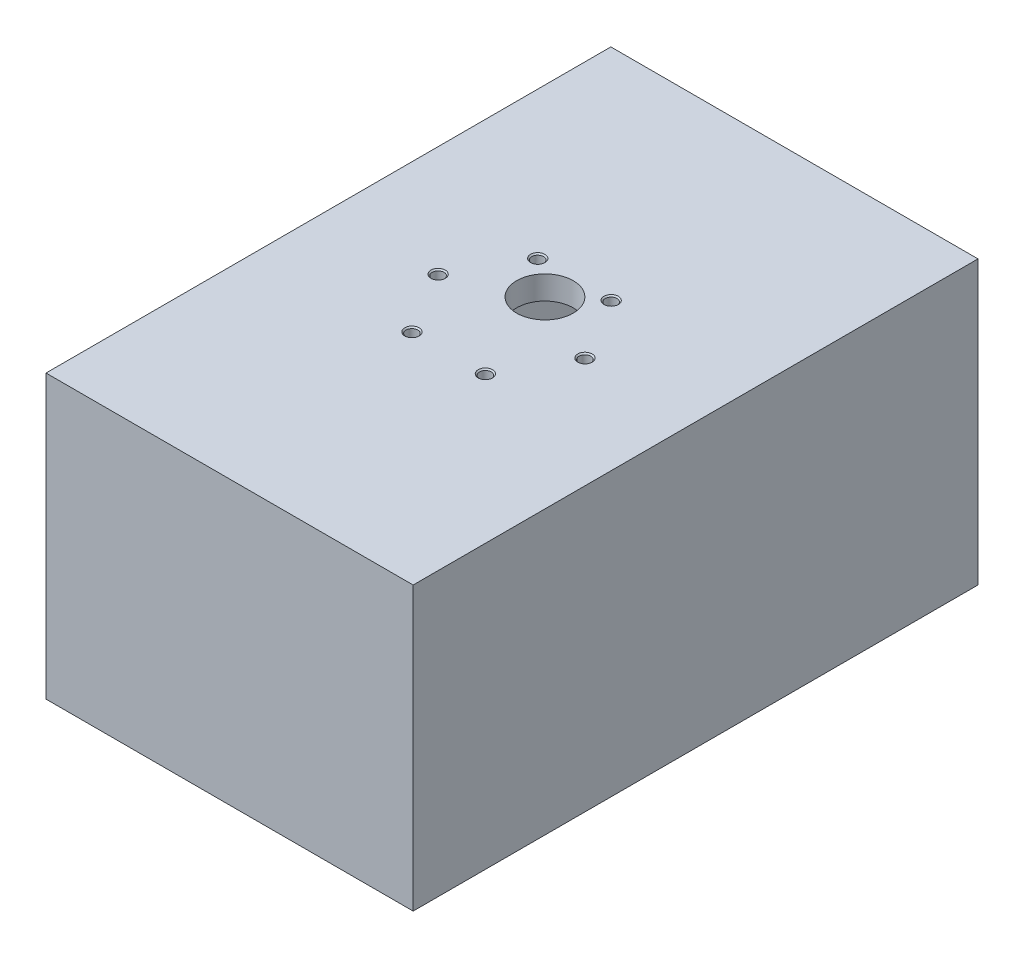
from build123d import *

# Parameters (mm, degrees)
IZIM1_R                     = 50
Y_KSEKLIK_EKSTR_ZYON1_DEPTH = 60
BO_ALTMA8_T                 = -5
IZIM2_R                     = 6
KES_EKSTR_ZYON1_DEPTH       = 60
DAIRESEL_KAPLAMA3_COUNT     = 6
IZIM6_R                     = 1.6
KES_EKSTR_ZYON2_DEPTH       = 4
DAIRESEL_KAPLAMA4_COUNT     = 6
IZIM7_W                     = 78
IZIM7_H                     = 120
Y_KSEKLIK_EKSTR_ZYON2_DEPTH = 60
KES_EKSTR_ZYON3_START       = -60
KES_EKSTR_ZYON3_DEPTH       = 60
BO_ALTMA9_T                 = -5
IZIM9_R                     = 6
KES_EKSTR_ZYON4_DEPTH       = 60
DAIRESEL_KAPLAMA5_COUNT     = 6


# Read off the part's stored shape, not the designer's step: M3x0.5 Dişli Delik1
with BuildPart() as part:
    # Çizim1 → Yükseklik-Ekstrüzyon1 (new body)
    with BuildSketch(Plane(origin=(0, 0, 0), x_dir=(1, 0, 0), z_dir=(0, 1, 0))):
        with Locations(Location((0, 0, 0), (0, 0, 270))):
            Circle(IZIM1_R)
    extrude(amount=Y_KSEKLIK_EKSTR_ZYON1_DEPTH)

    # İç Boşaltma8
    bo_altma8_openings = [part.faces().sort_by_distance(p)[0] for p in [
        (0, 0, 0),
    ]]
    offset(amount=BO_ALTMA8_T, openings=bo_altma8_openings, kind=Kind.INTERSECTION)

    # Çizim2 → Kes-Ekstrüzyon1 (cut)
    with BuildSketch(Plane(origin=(0, 60, 0), x_dir=(1, 0, 0), z_dir=(0, 1, 0))):
        with Locations(Location((0, 7, 0), (0, 0, 270))):
            Circle(IZIM2_R)
    extrude(amount=-KES_EKSTR_ZYON1_DEPTH, mode=Mode.SUBTRACT)

    # M3x0.5 Dişli Delik1 outline → M3x0.5 Dişli Delik1 (revolve, cut)
    with BuildSketch(Plane(origin=(15.5, 0, 0), x_dir=(1, 0, 0), z_dir=(0, 0, 1))):
        Polygon((0, 55), (1.25, 55), (1.25, 59.65), (1.6, 60), (0, 60), align=None)
    m3x0_5_di_li_delik1 = revolve(axis=Axis((15.5, 0, 0), (0, 1, 0)), mode=Mode.SUBTRACT)

    # Dairesel Kaplama3: M3x0.5 Dişli Delik1 ×6 about axis
    dairesel_kaplama3_axis = Axis((0, 0, 0), (0, 1, 0))
    for i in range(1, DAIRESEL_KAPLAMA3_COUNT):
        add(m3x0_5_di_li_delik1.rotate(dairesel_kaplama3_axis, i * 360 / DAIRESEL_KAPLAMA3_COUNT), mode=Mode.SUBTRACT)

    # Çizim6 → Kes-Ekstrüzyon2 (cut)
    with BuildSketch(Plane(origin=(0, 60, 0), x_dir=(1, 0, 0), z_dir=(0, 1, 0))):
        with Locations(Location((15.5, 0, 0), (0, 0, 270))):
            Circle(IZIM6_R)
    kes_ekstr_zyon2 = extrude(amount=-KES_EKSTR_ZYON2_DEPTH, mode=Mode.SUBTRACT)

    # Dairesel Kaplama4: Kes-Ekstrüzyon2 ×6 about axis
    dairesel_kaplama4_axis = Axis((0, 0, 0), (0, 1, 0))
    for i in range(1, DAIRESEL_KAPLAMA4_COUNT):
        add(kes_ekstr_zyon2.rotate(dairesel_kaplama4_axis, i * 360 / DAIRESEL_KAPLAMA4_COUNT), mode=Mode.SUBTRACT)

    # Çizim7 → Yükseklik-Ekstrüzyon2 (add)
    with BuildSketch(Plane(origin=(0, 60, 0), x_dir=(1, 0, 0), z_dir=(0, 1, 0))):
        Rectangle(IZIM7_W, IZIM7_H)
    extrude(amount=-Y_KSEKLIK_EKSTR_ZYON2_DEPTH)

    # Çizim8 → Kes-Ekstrüzyon3 (cut)
    with BuildSketch(Plane(origin=(0, 60, 0), x_dir=(1, 0, 0), z_dir=(0, 1, 0)).offset(KES_EKSTR_ZYON3_START)):
        with BuildLine():
            Line((-39, 31.288975694), (-39, -31.288975694))
            ThreePointArc((-39, -31.288975694), (-50, 0), (-39, 31.288975694))
        make_face()
        with BuildLine():
            Line((39, 31.288975694), (39, -31.288975694))
            ThreePointArc((39, -31.288975694), (50, 0), (39, 31.288975694))
        make_face()
    extrude(amount=KES_EKSTR_ZYON3_DEPTH, mode=Mode.SUBTRACT)

    # İç Boşaltma9
    bo_altma9_openings = [part.faces().sort_by_distance(p)[0] for p in [
        (0, 0, 0),
    ]]
    offset(amount=BO_ALTMA9_T, openings=bo_altma9_openings, kind=Kind.INTERSECTION)

    # Çizim9 → Kes-Ekstrüzyon4 (cut)
    with BuildSketch(Plane(origin=(0, 60, 0), x_dir=(1, 0, 0), z_dir=(0, 1, 0))):
        with Locations(Location((0, 7, 0), (0, 0, 270))):
            Circle(IZIM9_R)
    extrude(amount=-KES_EKSTR_ZYON4_DEPTH, mode=Mode.SUBTRACT)

    # Çizim16 → M3x0.5 Dişli Delik3 (revolve, cut)
    with BuildSketch(Plane(origin=(15.5, 60, 0), x_dir=(0, 0, 1), z_dir=(1, 0, 0))):
        Polygon((0, 0), (0, 9.251075774), (1.25, 8.5), (1.25, 0.275), (1.525, 0), align=None)
    m3x0_5_di_li_delik3 = revolve(axis=Axis((15.5, 66.35, 0), (0, -1, 0)), mode=Mode.SUBTRACT)

    # Dairesel Kaplama5: M3x0.5 Dişli Delik3 ×6 about axis
    dairesel_kaplama5_axis = Axis((-0.01225655, 0, 0.085683541), (0, 1, 0))
    for i in range(1, DAIRESEL_KAPLAMA5_COUNT):
        add(m3x0_5_di_li_delik3.rotate(dairesel_kaplama5_axis, i * 360 / DAIRESEL_KAPLAMA5_COUNT), mode=Mode.SUBTRACT)


solid = part.part
